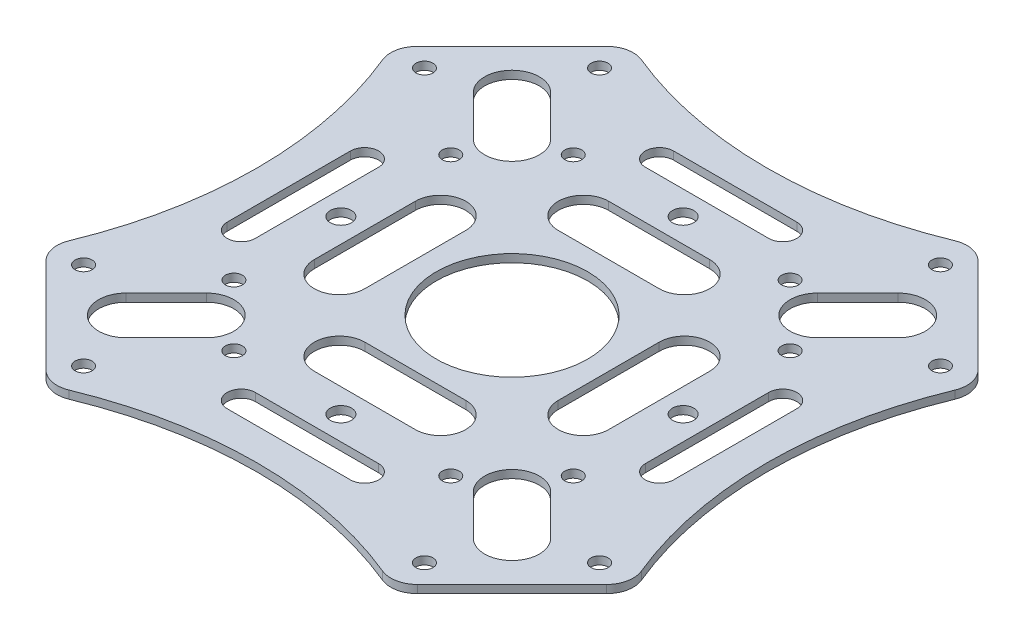
from build123d import *

# Parameters (mm, degrees)
SKETCH1_R           = 14.25
SKETCH1_R_2         = 2
SKETCH1_R_3         = 1.6
BOSS_EXTRUDE1_DEPTH = 0.75


with BuildPart() as part:
    # Sketch1 → Boss-Extrude1 (new, symmetric)
    with BuildSketch(Plane(origin=(0, 0, 0), x_dir=(1, 0, 0), z_dir=(0, 1, 0))):
        with BuildLine():
            Line((-34.937302436, 52.743938431), (-52.743938431, 34.937302436))
            ThreePointArc((-52.743938431, 34.937302436), (-54.111197998, 32.382898574), (-53.832221535, 29.499055662))
            ThreePointArc((-53.832221535, 29.499055662), (-48, 0), (-53.832221535, -29.499055662))
            ThreePointArc((-53.832221535, -29.499055662), (-54.111197998, -32.382898574), (-52.743938431, -34.937302436))
            Line((-52.743938431, -34.937302436), (-34.937302436, -52.743938431))
            ThreePointArc((-34.937302436, -52.743938431), (-32.382898574, -54.111197998), (-29.499055662, -53.832221535))
            ThreePointArc((-29.499055662, -53.832221535), (0, -48), (29.499055662, -53.832221535))
            ThreePointArc((29.499055662, -53.832221535), (32.382898574, -54.111197998), (34.937302436, -52.743938431))
            Line((34.937302436, -52.743938431), (52.743938431, -34.937302436))
            ThreePointArc((52.743938431, -34.937302436), (54.111197998, -32.382898574), (53.832221535, -29.499055662))
            ThreePointArc((53.832221535, -29.499055662), (48, 0), (53.832221535, 29.499055662))
            ThreePointArc((53.832221535, 29.499055662), (54.111197998, 32.382898574), (52.743938431, 34.937302436))
            Line((52.743938431, 34.937302436), (34.937302436, 52.743938431))
            ThreePointArc((34.937302436, 52.743938431), (32.382898574, 54.111197998), (29.499055662, 53.832221535))
            ThreePointArc((29.499055662, 53.832221535), (0, 48), (-29.499055662, 53.832221535))
            ThreePointArc((-29.499055662, 53.832221535), (-32.382898574, 54.111197998), (-34.937302436, 52.743938431))
        make_face()
        Circle(SKETCH1_R, mode=Mode.SUBTRACT)
        with Locations((-32.2, 0)):
            Circle(SKETCH1_R_2, mode=Mode.SUBTRACT)
        with Locations((-20.400030637, 31.925871171)):
            Circle(SKETCH1_R_3, mode=Mode.SUBTRACT)
        with Locations((-32.067292527, 48.542880528)):
            Circle(SKETCH1_R_3, mode=Mode.SUBTRACT)
        with Locations((-31.925871171, -20.400030637)):
            Circle(SKETCH1_R_3, mode=Mode.SUBTRACT)
        with Locations((-48.542880528, -32.067292527)):
            Circle(SKETCH1_R_3, mode=Mode.SUBTRACT)
        with Locations((20.400030637, -31.925871171)):
            Circle(SKETCH1_R_3, mode=Mode.SUBTRACT)
        with Locations((32.067292527, -48.542880528)):
            Circle(SKETCH1_R_3, mode=Mode.SUBTRACT)
        with Locations((31.925871171, 20.400030637)):
            Circle(SKETCH1_R_3, mode=Mode.SUBTRACT)
        with Locations((48.542880528, 32.067292527)):
            Circle(SKETCH1_R_3, mode=Mode.SUBTRACT)
        with Locations((32.067292527, 48.542880528)):
            Circle(SKETCH1_R_3, mode=Mode.SUBTRACT)
        with Locations((20.400030637, 31.925871171)):
            Circle(SKETCH1_R_3, mode=Mode.SUBTRACT)
        with Locations((48.542880528, -32.067292527)):
            Circle(SKETCH1_R_3, mode=Mode.SUBTRACT)
        with Locations((31.925871171, -20.400030637)):
            Circle(SKETCH1_R_3, mode=Mode.SUBTRACT)
        with Locations((-32.067292527, -48.542880528)):
            Circle(SKETCH1_R_3, mode=Mode.SUBTRACT)
        with Locations((-20.400030637, -31.925871171)):
            Circle(SKETCH1_R_3, mode=Mode.SUBTRACT)
        with Locations((-48.542880528, 32.067292527)):
            Circle(SKETCH1_R_3, mode=Mode.SUBTRACT)
        with Locations((-31.925871171, 20.400030637)):
            Circle(SKETCH1_R_3, mode=Mode.SUBTRACT)
        with Locations((0, 32.2)):
            Circle(SKETCH1_R_2, mode=Mode.SUBTRACT)
        with Locations((0, -32.2)):
            Circle(SKETCH1_R_2, mode=Mode.SUBTRACT)
        with Locations((32.2, 0)):
            Circle(SKETCH1_R_2, mode=Mode.SUBTRACT)
        with BuildLine():
            Line((9.5, -27.7), (-9.5, -27.7))
            ThreePointArc((-9.5, -27.7), (-14.25, -22.95), (-9.5, -18.2))
            Line((-9.5, -18.2), (9.5, -18.2))
            ThreePointArc((9.5, -18.2), (14.25, -22.95), (9.5, -27.7))
        make_face(mode=Mode.SUBTRACT)
        with BuildLine():
            Line((11.6, -42), (-11.6, -42))
            ThreePointArc((-11.6, -42), (-14.25, -39.35), (-11.6, -36.7))
            Line((-11.6, -36.7), (11.6, -36.7))
            ThreePointArc((11.6, -36.7), (14.25, -39.35), (11.6, -42))
        make_face(mode=Mode.SUBTRACT)
        with BuildLine():
            Line((32.385490578, -25.102290732), (39.951533137, -32.668333291))
            ThreePointArc((39.951533137, -32.668333291), (39.951533137, -39.951533137), (32.668333291, -39.951533137))
            Line((32.668333291, -39.951533137), (25.102290732, -32.385490578))
            ThreePointArc((25.102290732, -32.385490578), (25.102290732, -25.102290732), (32.385490578, -25.102290732))
        make_face(mode=Mode.SUBTRACT)
        with BuildLine():
            Line((-9.5, 27.7), (9.5, 27.7))
            ThreePointArc((9.5, 27.7), (14.25, 22.95), (9.5, 18.2))
            Line((9.5, 18.2), (-9.5, 18.2))
            ThreePointArc((-9.5, 18.2), (-14.25, 22.95), (-9.5, 27.7))
        make_face(mode=Mode.SUBTRACT)
        with BuildLine():
            Line((-11.6, 42), (11.6, 42))
            ThreePointArc((11.6, 42), (14.25, 39.35), (11.6, 36.7))
            Line((11.6, 36.7), (-11.6, 36.7))
            ThreePointArc((-11.6, 36.7), (-14.25, 39.35), (-11.6, 42))
        make_face(mode=Mode.SUBTRACT)
        with BuildLine():
            Line((-32.385490578, 25.102290732), (-39.951533137, 32.668333291))
            ThreePointArc((-39.951533137, 32.668333291), (-39.951533137, 39.951533137), (-32.668333291, 39.951533137))
            Line((-32.668333291, 39.951533137), (-25.102290732, 32.385490578))
            ThreePointArc((-25.102290732, 32.385490578), (-25.102290732, 25.102290732), (-32.385490578, 25.102290732))
        make_face(mode=Mode.SUBTRACT)
        with BuildLine():
            Line((25.102290732, 32.385490578), (32.668333291, 39.951533137))
            ThreePointArc((32.668333291, 39.951533137), (39.951533137, 39.951533137), (39.951533137, 32.668333291))
            Line((39.951533137, 32.668333291), (32.385490578, 25.102290732))
            ThreePointArc((32.385490578, 25.102290732), (25.102290732, 25.102290732), (25.102290732, 32.385490578))
        make_face(mode=Mode.SUBTRACT)
        with BuildLine():
            Line((-25.102290732, -32.385490578), (-32.668333291, -39.951533137))
            ThreePointArc((-32.668333291, -39.951533137), (-39.951533137, -39.951533137), (-39.951533137, -32.668333291))
            Line((-39.951533137, -32.668333291), (-32.385490578, -25.102290732))
            ThreePointArc((-32.385490578, -25.102290732), (-25.102290732, -25.102290732), (-25.102290732, -32.385490578))
        make_face(mode=Mode.SUBTRACT)
        with BuildLine():
            Line((-42, -11.6), (-42, 11.6))
            ThreePointArc((-42, 11.6), (-39.35, 14.25), (-36.7, 11.6))
            Line((-36.7, 11.6), (-36.7, -11.6))
            ThreePointArc((-36.7, -11.6), (-39.35, -14.25), (-42, -11.6))
        make_face(mode=Mode.SUBTRACT)
        with BuildLine():
            Line((-27.7, -9.5), (-27.7, 9.5))
            ThreePointArc((-27.7, 9.5), (-22.95, 14.25), (-18.2, 9.5))
            Line((-18.2, 9.5), (-18.2, -9.5))
            ThreePointArc((-18.2, -9.5), (-22.95, -14.25), (-27.7, -9.5))
        make_face(mode=Mode.SUBTRACT)
        with BuildLine():
            Line((42, 11.6), (42, -11.6))
            ThreePointArc((42, -11.6), (39.35, -14.25), (36.7, -11.6))
            Line((36.7, -11.6), (36.7, 11.6))
            ThreePointArc((36.7, 11.6), (39.35, 14.25), (42, 11.6))
        make_face(mode=Mode.SUBTRACT)
        with BuildLine():
            Line((27.7, 9.5), (27.7, -9.5))
            ThreePointArc((27.7, -9.5), (22.95, -14.25), (18.2, -9.5))
            Line((18.2, -9.5), (18.2, 9.5))
            ThreePointArc((18.2, 9.5), (22.95, 14.25), (27.7, 9.5))
        make_face(mode=Mode.SUBTRACT)
    extrude(amount=BOSS_EXTRUDE1_DEPTH, both=True)


solid = part.part
